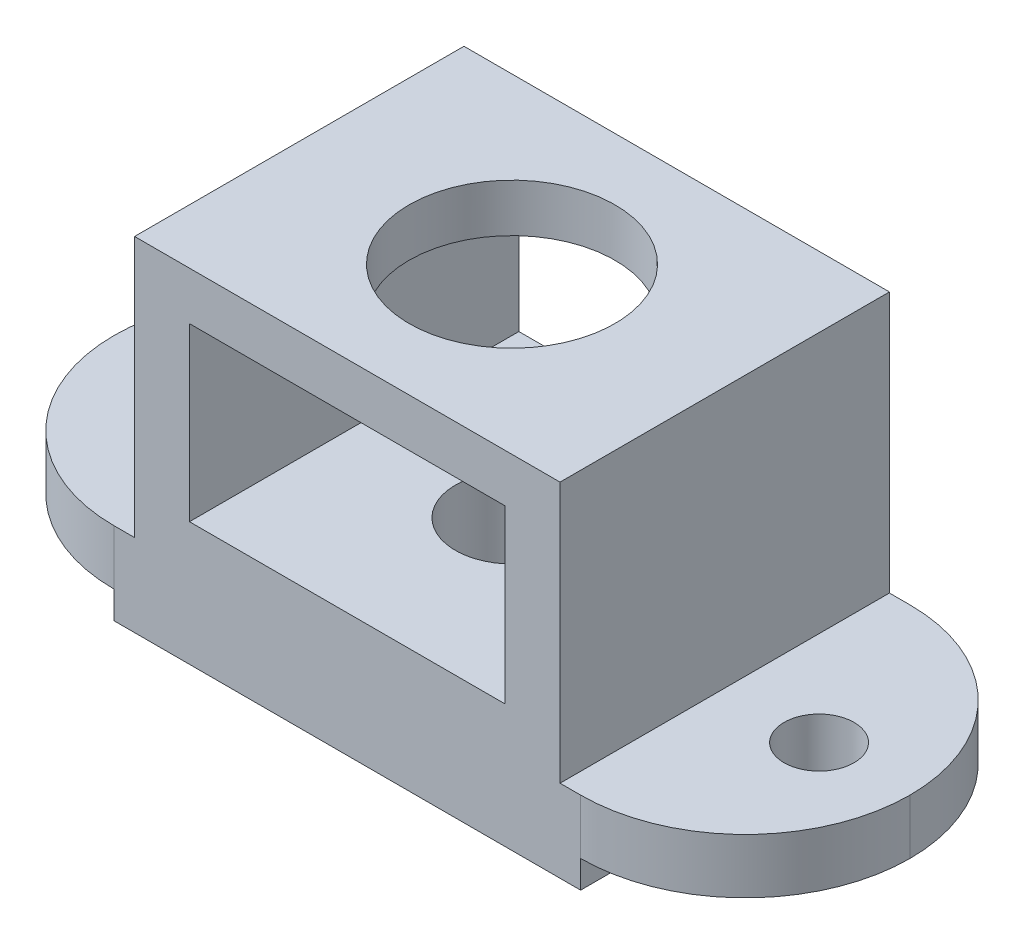
from build123d import *

# Parameters (mm, degrees)
EXTRUDE_1_DEPTH     = 48
FILLET_1_R          = 24
FILLET_2_R          = 24
FILLET_3_R          = 24
FILLET_4_R          = 24
SKETCH_8_W          = 46
SKETCH_8_H          = 25
CUT_EXTRUDE_2_DEPTH = 134.701159307
SKETCH_9_R          = 5.1
CUT_EXTRUDE_3_DEPTH = 48
SKETCH_11_R         = 8.25
CUT_EXTRUDE_4_DEPTH = 18
SKETCH_12_R         = 15
CUT_EXTRUDE_5_DEPTH = 7


with BuildPart() as part:
    # Эскиз1 → Бобышка-Вытянуть1 (new body)
    with BuildSketch(Plane.XY):
        Polygon((0, 0), (24, 0), (24, -4), (92, -4), (92, 0), (116, 0), (116, 8), (89, 8), (89, 46), (27, 46), (27, 8), (0, 8), align=None)
    extrude(amount=EXTRUDE_1_DEPTH)

    # Скругление1
    fillet_1_edges = [part.edges().sort_by_distance(p)[0] for p in [
        (0, 4, 48),
    ]]
    fillet(fillet_1_edges, radius=FILLET_1_R)

    # Скругление2
    fillet_2_edges = [part.edges().sort_by_distance(p)[0] for p in [
        (0, 4, 0),
    ]]
    fillet(fillet_2_edges, radius=FILLET_2_R - 0.0001)  # a hair under: the kernel refuses the full size

    # Скругление3
    fillet_3_edges = [part.edges().sort_by_distance(p)[0] for p in [
        (116, 4, 0),
    ]]
    fillet(fillet_3_edges, radius=FILLET_3_R)

    # Скругление4
    fillet_4_edges = [part.edges().sort_by_distance(p)[0] for p in [
        (116, 4, 48),
    ]]
    fillet(fillet_4_edges, radius=FILLET_4_R - 0.0001)  # a hair under: the kernel refuses the full size

    # Эскиз8 → Вырез-Вытянуть2 (cut, through all)
    with BuildSketch(Plane.XY.offset(48)):
        with Locations((58, 26.5)):
            Rectangle(SKETCH_8_W, SKETCH_8_H)
    extrude(amount=-CUT_EXTRUDE_2_DEPTH, mode=Mode.SUBTRACT)

    # Эскиз9 → Вырез-Вытянуть3 (cut)
    with BuildSketch(Plane.XZ.offset(4)):
        with Locations(Location((12.743315918, 24, 0), (0, 0, 270))):
            Circle(SKETCH_9_R)
        with Locations((102.743315918, 24)):
            Circle(SKETCH_9_R)
    extrude(amount=-CUT_EXTRUDE_3_DEPTH, mode=Mode.SUBTRACT)

    # Эскиз11 → Вырез-Вытянуть4 (cut)
    with BuildSketch(Plane.XZ.offset(4)):
        with Locations(Location((58, 24, 0), (0, 0, 270))):
            Circle(SKETCH_11_R)
    extrude(amount=-CUT_EXTRUDE_4_DEPTH, mode=Mode.SUBTRACT)

    # Эскиз12 → Вырез-Вытянуть5 (cut)
    with BuildSketch(Plane(origin=(0, 46, 0), x_dir=(1, 0, 0), z_dir=(0, 1, 0))):
        with Locations(Location((58, -24, 0), (0, 0, 180))):
            Circle(SKETCH_12_R)
    extrude(amount=-CUT_EXTRUDE_5_DEPTH, mode=Mode.SUBTRACT)


solid = part.part
